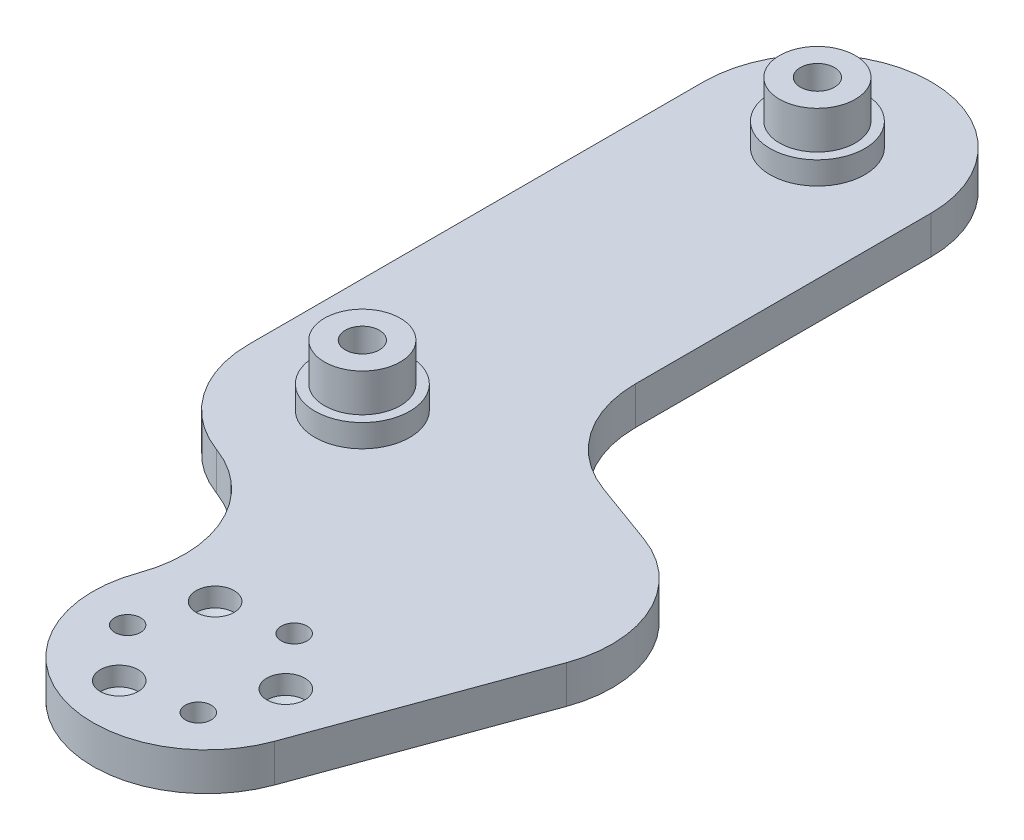
from build123d import *

# Parameters (mm, degrees)
EXTRUDE_1_DEPTH              = 5
SKETCH_2_R                   = 6.25
EXTRUDE_2_DEPTH              = 3
SKETCH_3_R                   = 5
EXTRUDE_3_DEPTH              = 5
HOLE_WIZARD_M4_3_D           = 4.5
HOLE_WIZARD_M4_3_CBORE_D     = 8
HOLE_WIZARD_M4_3_CBORE_DEPTH = 4.4
EXTRUDE_4_DEPTH              = 5
EXTRUDE_5_DEPTH              = 5
HOLE_WIZARD_M4_2_D           = 4.5
HOLE_WIZARD_M4_2_CBORE_D     = 8
HOLE_WIZARD_M4_2_CBORE_DEPTH = 4.4
HOLE_WIZARD_M3_1_D           = 3.4
HOLE_WIZARD_M3_1_CBORE_D     = 6.5
HOLE_WIZARD_M3_1_CBORE_DEPTH = 2.5
PATTERN_CIRCULAR_1_COUNT     = 3
PATTERN_CIRCULAR_2_COUNT     = 3
FILLET_2_R                   = 15


with BuildPart() as part:
    # 스케치1 → 보스-돌출1 (new body)
    with BuildSketch(Plane(origin=(0, 0, 0), x_dir=(1, 0, 0), z_dir=(0, 1, 0))):
        with BuildLine():
            Line((-15, 0), (-15, 60))
            ThreePointArc((-15, 60), (0, 75), (15, 60))
            Line((15, 60), (15, 0))
            ThreePointArc((15, 0), (0, -15), (-15, 0))
        make_face()
    extrude(amount=EXTRUDE_1_DEPTH)

    # 스케치2 → 보스-돌출2 (add)
    with BuildSketch(Plane(origin=(0, 5, 0), x_dir=(1, 0, 0), z_dir=(0, 1, 0))):
        with Locations(Location((0, 60, 0), (0, 0, 270))):
            Circle(SKETCH_2_R)
        with Locations(Location((0, 0, 0), (0, 0, 270))):
            Circle(SKETCH_2_R)
    extrude(amount=EXTRUDE_2_DEPTH)

    # 스케치3 → 보스-돌출3 (add)
    with BuildSketch(Plane(origin=(0, 8, 0), x_dir=(1, 0, 0), z_dir=(0, 1, 0))):
        with Locations(Location((0, 60, 0), (0, 0, 270))):
            Circle(SKETCH_3_R)
        with Locations(Location((0, 0, 0), (0, 0, 270))):
            Circle(SKETCH_3_R)
    extrude(amount=EXTRUDE_3_DEPTH)

    # M4 육각 소켓 머리 캡 나사용 카운터보어3 (through all)
    with Locations(Plane(origin=(0, 0, 0), x_dir=(-1, 0, 0), z_dir=(0, -1, 0))):
        with Locations((0, 60), (0, -25)):
            CounterBoreHole(HOLE_WIZARD_M4_3_D / 2, HOLE_WIZARD_M4_3_CBORE_D / 2, HOLE_WIZARD_M4_3_CBORE_DEPTH)

    # 스케치8 → 보스-돌출4 (add)
    with BuildSketch(Plane.XZ):
        with BuildLine():
            Line((-5.13030215, 14.095389312), (23.060476474, 24.355993612))
            ThreePointArc((23.060476474, 24.355993612), (42.286167935, 15.39090645), (33.321080773, -3.834785012))
            Line((33.321080773, -3.834785012), (15, -10.503113073))
            Line((15, -10.503113073), (15, 0))
            ThreePointArc((15, 0), (8.603646545, 12.287280664), (-5.13030215, 14.095389312))
        make_face()
    extrude(amount=-EXTRUDE_4_DEPTH)

    # 스케치9 → 보스-돌출5 (add)
    with BuildSketch(Plane.XZ):
        with BuildLine():
            Line((14.095389312, 5.13030215), (3.834785012, 33.321080773))
            ThreePointArc((3.834785012, 33.321080773), (12.799872174, 52.546772235), (32.025563636, 43.581685073))
            Line((32.025563636, 43.581685073), (42.286167935, 15.39090645))
            ThreePointArc((42.286167935, 15.39090645), (33.321080773, -3.834785012), (14.095389312, 5.13030215))
        make_face()
    extrude(amount=-EXTRUDE_5_DEPTH)

    # M4 육각 소켓 머리 캡 나사용 카운터보어2 (through all)
    with Locations(Plane(origin=(0, 0, 0), x_dir=(-1, 0, 0), z_dir=(0, -1, 0))):
        with Locations((0, 0)):
            CounterBoreHole(HOLE_WIZARD_M4_2_D / 2, HOLE_WIZARD_M4_2_CBORE_D / 2, HOLE_WIZARD_M4_2_CBORE_DEPTH)

    # M3 육각 소켓 머리 캡 나사용 카운터보어1 (through all)
    with Locations(Plane(origin=(0, 0, 0), x_dir=(-1, 0, 0), z_dir=(0, -1, 0))):
        with Locations((-21.008355614, -29.994149336)):
            hole_wizard_m3_1 = CounterBoreHole(HOLE_WIZARD_M3_1_D / 2, HOLE_WIZARD_M3_1_CBORE_D / 2, HOLE_WIZARD_M3_1_CBORE_DEPTH)

    # 원형 패턴1: M3 육각 소켓 머리 캡 나사용 카운터보어1 ×3 about axis
    pattern_circular_1_axis = Axis((17.930174324, 0, 38.451382923), (0, 1, 0))
    for i in range(1, PATTERN_CIRCULAR_1_COUNT):
        add(hole_wizard_m3_1.rotate(pattern_circular_1_axis, i * 360 / PATTERN_CIRCULAR_1_COUNT), mode=Mode.SUBTRACT)

    # 스케치36 → Ø5.0mm 맞춤핀 구멍1 (revolve, cut)
    with BuildSketch(Plane(origin=(14.851993034, 5, 46.90861651), x_dir=(0, 0, 1), z_dir=(1, 0, 0))):
        Polygon((0, 0), (0, 4.002151548), (2.5, 2.5), (2.5, 0), align=None)
    f_5_0mm_1 = revolve(axis=Axis((14.851993034, 11.35, 46.90861651), (0, -1, 0)), mode=Mode.SUBTRACT)

    # 원형 패턴2: Ø5.0mm 맞춤핀 구멍1 ×3 about axis
    pattern_circular_2_axis = Axis((17.930174324, 0, 38.451382923), (0, 1, 0))
    for i in range(1, PATTERN_CIRCULAR_2_COUNT):
        add(f_5_0mm_1.rotate(pattern_circular_2_axis, i * 360 / PATTERN_CIRCULAR_2_COUNT), mode=Mode.SUBTRACT)

    # 필렛2
    fillet_2_edges = [part.edges().sort_by_distance(p)[0] for p in [
        (15, 2.5, -10.503113073),
        (8.965087162, 2.5, 19.225691462),
    ]]
    fillet(fillet_2_edges, radius=FILLET_2_R - 0.0001)  # a hair under: the kernel refuses the full size


solid = part.part
